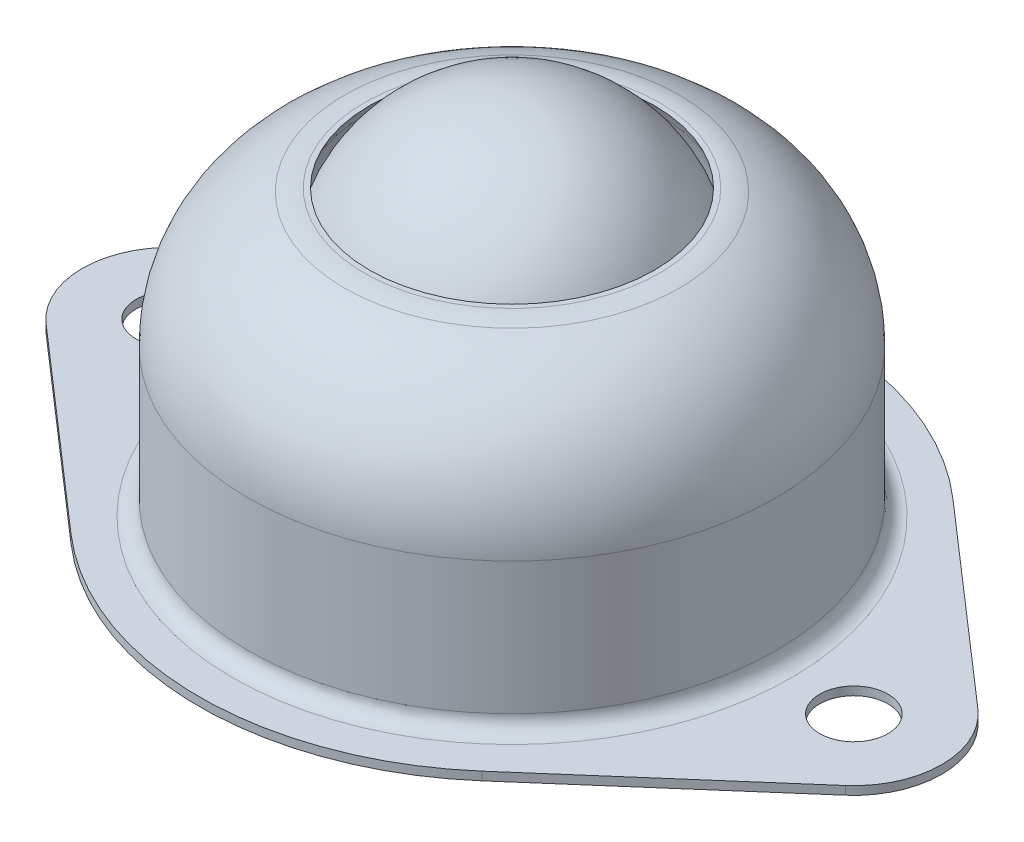
from build123d import *

# Parameters (mm, degrees)
SKETCH2_R           = 2.778125
BOSS_EXTRUDE1_DEPTH = 0.6858
FILLET1_R           = 1.27
FILLET3_R           = 5.08
FILLET4_R           = 1.905
FILLET5_R           = 2.54
SKETCH8_W           = 1.27
SKETCH8_H           = 17.4625


# Read off the part's stored shape, not the designer's step: Shell1, Move Face1, DeleteFace1
with BuildPart() as part:
    # Sketch2 → Boss-Extrude1 (new body)
    with BuildSketch(Plane(origin=(0, 0, 0), x_dir=(1, 0, 0), z_dir=(0, 1, 0))):
        with BuildLine():
            Line((16.691428571, -19.145657791), (32.475714286, -5.384716254))
            ThreePointArc((32.475714286, -5.384716254), (34.925, 0), (32.475714286, 5.384716254))
            Line((32.475714286, 5.384716254), (16.691428571, 19.145657791))
            ThreePointArc((16.691428571, 19.145657791), (0, 25.4), (-16.691428571, 19.145657791))
            Line((-16.691428571, 19.145657791), (-32.475714286, 5.384716254))
            ThreePointArc((-32.475714286, 5.384716254), (-34.925, 0), (-32.475714286, -5.384716254))
            Line((-32.475714286, -5.384716254), (-16.691428571, -19.145657791))
            ThreePointArc((-16.691428571, -19.145657791), (0, -25.4), (16.691428571, -19.145657791))
        make_face()
        with Locations(Location((-27.78125, 0, 0), (0, 0, 270))):
            Circle(SKETCH2_R, mode=Mode.SUBTRACT)
        with Locations(Location((27.78125, 0, 0), (0, 0, 270))):
            Circle(SKETCH2_R, mode=Mode.SUBTRACT)
    extrude(amount=BOSS_EXTRUDE1_DEPTH)

    # Sketch1 → Revolve1 (revolve)
    with BuildSketch(Plane.XY, mode=Mode.PRIVATE) as revolve1_sk:
        with BuildLine():
            Line((12.7, 23.8125), (0, 23.8125))
            Line((0, 23.8125), (0, 0))
            Line((0, 0), (21.43125, 0))
            Line((21.43125, 0), (21.43125, 12.7))
            ThreePointArc((21.43125, 12.7), (18.987326705, 19.766158483), (12.7, 23.8125))
        make_face()
    revolve(revolve1_sk.sketch.rotate(Axis((0, 23.8125, 0), (0, -1, 0)), 90), axis=Axis((0, 23.8125, 0), (0, -1, 0)))

    # Fillet1
    fillet1_edges = [part.edges().sort_by_distance(p)[0] for p in [
        (0, 0.6858, -21.43125),
    ]]
    fillet(fillet1_edges, radius=FILLET1_R)

    # Fillet3
    fillet3_edges = [part.edges().sort_by_distance(p)[0] for p in [
        (0, 23.8125, -12.7),
    ]]
    fillet(fillet3_edges, radius=FILLET3_R)

    # Shell1 outline → Shell1 (revolve, cut)
    with BuildSketch(Plane.XY):
        with BuildLine():
            Line((20.41525, 1.9558), (20.41525, 12.7))
            ThreePointArc((20.41525, 12.7), (18.445864163, 18.796581785), (13.282049846, 22.588917707))
            ThreePointArc((13.282049846, 22.588917707), (12.649277089, 22.744268785), (11.999810216, 22.7965))
            Line((11.999810216, 22.7965), (0, 22.7965))
            Line((0, 22.7965), (0, 0))
            Line((0, 0), (21.517762628, 0))
            ThreePointArc((21.517762628, 0), (20.709862527, 0.833226201), (20.41525, 1.9558))
        make_face()
    revolve(axis=Axis((0, 0, 0), (0, 1, 0)), mode=Mode.SUBTRACT)

    # Sketch6 → Cut-Revolve1 (revolve, cut)
    with BuildSketch(Plane.XY):
        with BuildLine():
            Line((0, 30.1625), (0, 4.7625))
            ThreePointArc((0, 4.7625), (12.7, 17.4625), (0, 30.1625))
        make_face()
    revolve(axis=Axis((0, 30.1625, 0), (0, -1, 0)), mode=Mode.SUBTRACT)

    # Move Face1 outline → Move Face1 (revolve, cut)
    with BuildSketch(Plane.XY):
        with BuildLine():
            Line((11.999810216, 22.795639967), (12.083413512, 22.795639967))
            ThreePointArc((12.083413512, 22.795639967), (11.843323815, 23.309460322), (11.581397319, 23.812500012))
            Line((11.581397319, 23.812500012), (10.998522622, 23.812500011))
            ThreePointArc((10.998522622, 23.812500011), (11.273490805, 23.310440242), (11.525556131, 22.796499988))
            Line((11.525556131, 22.796499988), (11.999810216, 22.7965))
            Line((11.999810216, 22.7965), (11.999810216, 22.795639967))
        make_face()
    revolve(axis=Axis((0, 0, 0), (0, 1, 0)), mode=Mode.SUBTRACT)

    # DeleteFace1 outline → DeleteFace1 (revolve)
    with BuildSketch(Plane.XY):
        with BuildLine():
            Line((20.41525, 1.9558), (20.41525, 0))
            Line((20.41525, 0), (21.517762628, 0))
            ThreePointArc((21.517762628, 0), (20.709862527, 0.833226201), (20.41525, 1.9558))
        make_face()
    revolve(axis=Axis((0, 0, 0), (0, 1, 0)))

    # Fillet4
    fillet4_edges = [part.edges().sort_by_distance(p)[0] for p in [
        (-20.41525, 0, 0),
    ]]
    fillet(fillet4_edges, radius=FILLET4_R)


with BuildPart() as body_2:
    # Sketch3 → Revolve2 (revolve)
    with BuildSketch(Plane.XY):
        with BuildLine():
            Line((0, 30.1625), (0, 4.7625))
            ThreePointArc((0, 4.7625), (12.7, 17.4625), (0, 30.1625))
        make_face()
    revolve(axis=Axis((0, 30.1625, 0), (0, -1, 0)))


with BuildPart() as body_3:
    # Sketch7 → Revolve3 (revolve)
    with BuildSketch(Plane.XY, mode=Mode.PRIVATE) as revolve3_sk:
        with BuildLine():
            Line((19.72945, 0.6858), (19.72945, 12.7))
            ThreePointArc((19.72945, 12.7), (17.920077669, 18.352977633), (13.164521204, 21.90469089))
            ThreePointArc((13.164521204, 21.90469089), (11.286199321, 9.35945222), (0, 3.5687))
            Line((0, 3.5687), (0, 4.2545))
            ThreePointArc((0, 4.2545), (11.102842389, 10.308609109), (12.027335408, 22.920930818))
            ThreePointArc((12.027335408, 22.920930818), (18.049815029, 19.311061526), (20.41525, 12.7))
            Line((20.41525, 12.7), (20.41525, 0.6858))
            Line((20.41525, 0.6858), (19.72945, 0.6858))
        make_face()
    revolve(revolve3_sk.sketch.rotate(Axis((0, 23.8125, 0), (0, -1, 0)), 90), axis=Axis((0, 23.8125, 0), (0, -1, 0)))

    # Fillet5
    fillet5_edges = [body_3.edges().sort_by_distance(p)[0] for p in [
        (0, 21.90469089, -13.164521204),
    ]]
    fillet(fillet5_edges, radius=FILLET5_R)

    # Sketch8 → Cut-Revolve2 (revolve, cut)
    with BuildSketch(Plane.XY, mode=Mode.PRIVATE) as cut_revolve2_sk:
        with Locations((0.635, 8.73125)):
            Rectangle(SKETCH8_W, SKETCH8_H)
    revolve(cut_revolve2_sk.sketch.rotate(Axis((0, 23.8125, 0), (0, -1, 0)), 90), axis=Axis((0, 23.8125, 0), (0, -1, 0)), mode=Mode.SUBTRACT)


solid = Compound([part.part, body_2.part, body_3.part])
